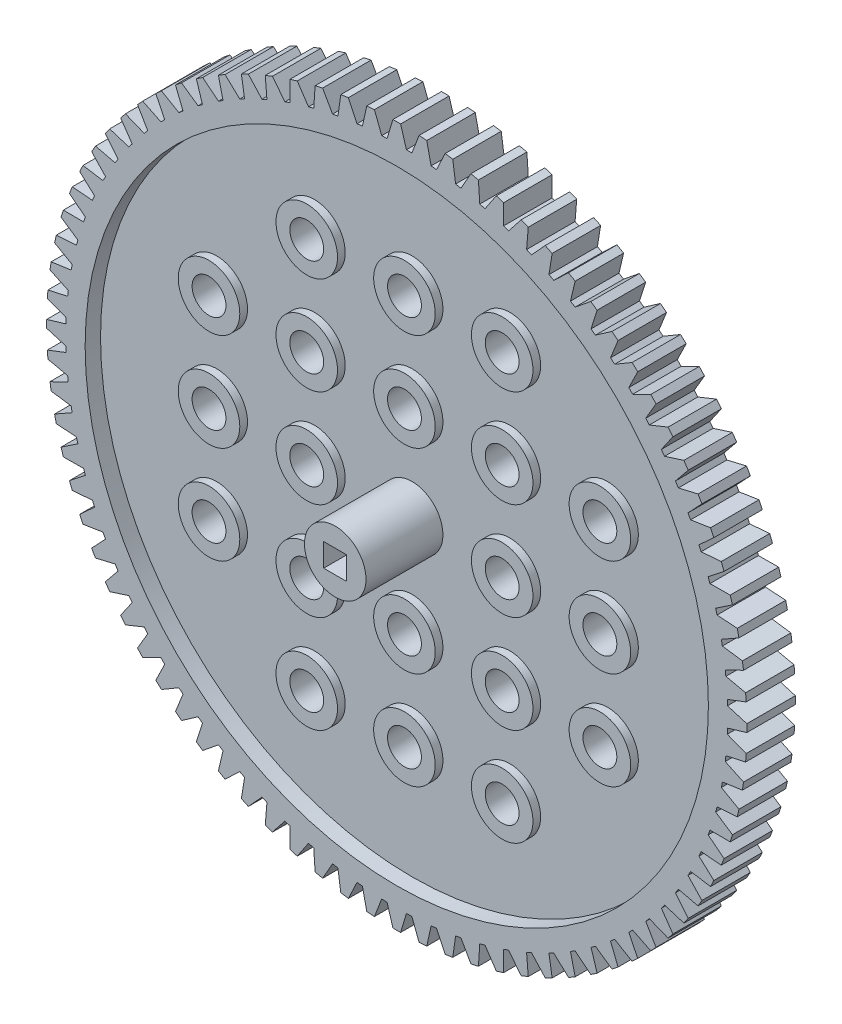
from build123d import *

# Parameters (mm, degrees)
SKETCH1_W           = 3
SKETCH1_H           = 3
BOSS_EXTRUDE1_DEPTH = 6.3
SKETCH2_R           = 2.2
CUT_EXTRUDE1_DEPTH  = 16.3
SKETCH3_R           = 40.5
CUT_EXTRUDE2_DEPTH  = 2
CUT_EXTRUDE3_START  = -2
SKETCH4_R           = 40.5
CUT_EXTRUDE3_DEPTH  = 2
BOSS_EXTRUDE2_START = 1
SKETCH5_R           = 4
SKETCH5_R_2         = 2.2
BOSS_EXTRUDE2_DEPTH = 1
SKETCH6_R           = 5.75
SKETCH6_R_2         = 4.25
BOSS_EXTRUDE3_DEPTH = 2
SKETCH7_R           = 4
SKETCH7_W           = 3
SKETCH7_H           = 3
BOSS_EXTRUDE4_DEPTH = 2
BOSS_EXTRUDE5_START = 2
SKETCH8_R           = 4
SKETCH8_W           = 3
SKETCH8_H           = 3
BOSS_EXTRUDE5_DEPTH = 2
SKETCH9_R           = 4
SKETCH9_W           = 3
SKETCH9_H           = 3
BOSS_EXTRUDE6_DEPTH = 8


with BuildPart() as part:
    # Sketch1 → Boss-Extrude1 (new body)
    with BuildSketch(Plane.XY):
        with BuildLine():
            Line((0.5, 45.5), (-0.5, 45.5))
            Line((-0.5, 45.5), (-1.255499823, 42.981667257))
            ThreePointArc((-1.255499823, 42.981667257), (-1.607821354, 42.969930306), (-1.960034826, 42.955305417))
            Line((-1.960034826, 42.955305417), (-2.90161736, 45.410137819))
            Line((-2.90161736, 45.410137819), (-3.898821157, 45.335407725))
            Line((-3.898821157, 45.335407725), (-4.464013207, 42.767658179))
            ThreePointArc((-4.464013207, 42.767658179), (-4.814472472, 42.729625025), (-5.164608165, 42.688720085))
            Line((-5.164608165, 42.688720085), (-6.287007698, 45.066323726))
            Line((-6.287007698, 45.066323726), (-7.275838524, 44.91728146))
            Line((-7.275838524, 44.91728146), (-7.647562019, 42.314475008))
            ThreePointArc((-7.647562019, 42.314475008), (-7.994199108, 42.250358349), (-8.34029892, 42.183402114))
            Line((-8.34029892, 42.183402114), (-9.637238539, 44.470480471))
            Line((-9.637238539, 44.470480471), (-10.612166451, 44.247959537))
            Line((-10.612166451, 44.247959537), (-10.788342562, 41.624652128))
            ThreePointArc((-10.788342562, 41.624652128), (-11.129218939, 41.53481053), (-11.46934734, 41.442177447))
            Line((-11.46934734, 41.442177447), (-12.933574033, 43.62594025))
            Line((-12.933574033, 43.62594025), (-13.889146839, 43.331185076))
            Line((-13.889146839, 43.331185076), (-13.868790317, 40.702047309))
            ThreePointArc((-13.868790317, 40.702047309), (-14.201999664, 40.586983203), (-14.534254518, 40.469191314))
            Line((-14.534254518, 40.469191314), (-16.157579734, 42.537426075))
            Line((-16.157579734, 42.537426075), (-17.088453483, 42.172085051))
            Line((-17.088453483, 42.172085051), (-16.871678171, 39.551820131))
            ThreePointArc((-16.871678171, 39.551820131), (-17.195357046, 39.412177002), (-17.517880249, 39.269885047))
            Line((-17.517880249, 39.269885047), (-19.291225696, 41.211025359))
            Line((-19.291225696, 41.211025359), (-20.192194564, 40.77714162))
            Line((-20.192194564, 40.77714162), (-19.780212757, 38.180403132))
            ThreePointArc((-19.780212757, 38.180403132), (-20.092551016, 38.016961921), (-20.403538887, 37.850965653))
            Line((-20.403538887, 37.850965653), (-22.316987298, 39.654155872))
            Line((-22.316987298, 39.654155872), (-23.183012702, 39.154155872))
            Line((-23.183012702, 39.154155872), (-22.57812837, 36.59546583))
            ThreePointArc((-22.57812837, 36.59546583), (-22.87737929, 36.409140567), (-23.17509266, 36.220368306))
            Line((-23.17509266, 36.220368306), (-25.217943255, 37.87552426))
            Line((-25.217943255, 37.87552426), (-26.044182029, 37.312204202))
            Line((-26.044182029, 37.312204202), (-25.24977793, 34.805871839))
            ThreePointArc((-25.24977793, 34.805871839), (-25.53426798, 34.59770453), (-25.817041914, 34.387211966))
            Line((-25.817041914, 34.387211966), (-27.977870243, 35.885077353))
            Line((-27.977870243, 35.885077353), (-28.759701726, 35.261587551))
            Line((-28.759701726, 35.261587551), (-27.780220489, 32.821629295))
            ThreePointArc((-27.780220489, 32.821629295), (-28.048358685, 32.592784095), (-28.314611797, 32.361748389))
            Line((-28.314611797, 32.361748389), (-30.581333633, 33.693946537))
            Line((-30.581333633, 33.693946537), (-31.314385504, 33.013773799))
            Line((-31.314385504, 33.013773799), (-30.155304787, 30.653834885))
            ThreePointArc((-30.155304787, 30.653834885), (-30.405591591, 30.405591591), (-30.653834885, 30.155304787))
            Line((-30.653834885, 30.155304787), (-33.013773799, 31.314385504))
            Line((-33.013773799, 31.314385504), (-33.693946537, 30.581333633))
            Line((-33.693946537, 30.581333633), (-32.361748389, 28.314611797))
            ThreePointArc((-32.361748389, 28.314611797), (-32.592784095, 28.048358685), (-32.821629295, 27.780220489))
            Line((-32.821629295, 27.780220489), (-35.261587551, 28.759701726))
            Line((-35.261587551, 28.759701726), (-35.885077353, 27.977870243))
            Line((-35.885077353, 27.977870243), (-34.387211966, 25.817041914))
            ThreePointArc((-34.387211966, 25.817041914), (-34.59770453, 25.53426798), (-34.805871839, 25.24977793))
            Line((-34.805871839, 25.24977793), (-37.312204202, 26.044182029))
            Line((-37.312204202, 26.044182029), (-37.87552426, 25.217943255))
            Line((-37.87552426, 25.217943255), (-36.220368306, 23.17509266))
            ThreePointArc((-36.220368306, 23.17509266), (-36.409140567, 22.87737929), (-36.59546583, 22.57812837))
            Line((-36.59546583, 22.57812837), (-39.154155872, 23.183012702))
            Line((-39.154155872, 23.183012702), (-39.654155872, 22.316987298))
            Line((-39.654155872, 22.316987298), (-37.850965653, 20.403538887))
            ThreePointArc((-37.850965653, 20.403538887), (-38.016961921, 20.092551016), (-38.180403132, 19.780212757))
            Line((-38.180403132, 19.780212757), (-40.77714162, 20.192194564))
            Line((-40.77714162, 20.192194564), (-41.211025359, 19.291225696))
            Line((-41.211025359, 19.291225696), (-39.269885047, 17.517880249))
            ThreePointArc((-39.269885047, 17.517880249), (-39.412177002, 17.195357046), (-39.551820131, 16.871678171))
            Line((-39.551820131, 16.871678171), (-42.172085051, 17.088453483))
            Line((-42.172085051, 17.088453483), (-42.537426075, 16.157579734))
            Line((-42.537426075, 16.157579734), (-40.469191314, 14.534254518))
            ThreePointArc((-40.469191314, 14.534254518), (-40.586983203, 14.201999664), (-40.702047309, 13.868790317))
            Line((-40.702047309, 13.868790317), (-43.331185076, 13.889146839))
            Line((-43.331185076, 13.889146839), (-43.62594025, 12.933574033))
            Line((-43.62594025, 12.933574033), (-41.442177447, 11.46934734))
            ThreePointArc((-41.442177447, 11.46934734), (-41.53481053, 11.129218939), (-41.624652128, 10.788342562))
            Line((-41.624652128, 10.788342562), (-44.247959537, 10.612166451))
            Line((-44.247959537, 10.612166451), (-44.470480471, 9.637238539))
            Line((-44.470480471, 9.637238539), (-42.183402114, 8.34029892))
            ThreePointArc((-42.183402114, 8.34029892), (-42.250358349, 7.994199108), (-42.314475008, 7.647562019))
            Line((-42.314475008, 7.647562019), (-44.91728146, 7.275838524))
            Line((-44.91728146, 7.275838524), (-45.066323726, 6.287007698))
            Line((-45.066323726, 6.287007698), (-42.688720085, 5.164608165))
            ThreePointArc((-42.688720085, 5.164608165), (-42.729625025, 4.814472472), (-42.767658179, 4.464013207))
            Line((-42.767658179, 4.464013207), (-45.335407725, 3.898821157))
            Line((-45.335407725, 3.898821157), (-45.410137819, 2.90161736))
            Line((-45.410137819, 2.90161736), (-42.955305417, 1.960034826))
            ThreePointArc((-42.955305417, 1.960034826), (-42.969930306, 1.607821354), (-42.981667257, 1.255499823))
            Line((-42.981667257, 1.255499823), (-45.5, 0.5))
            Line((-45.5, 0.5), (-45.5, -0.5))
            Line((-45.5, -0.5), (-42.981667257, -1.255499823))
            ThreePointArc((-42.981667257, -1.255499823), (-42.969930306, -1.607821354), (-42.955305417, -1.960034826))
            Line((-42.955305417, -1.960034826), (-45.410137819, -2.90161736))
            Line((-45.410137819, -2.90161736), (-45.335407725, -3.898821157))
            Line((-45.335407725, -3.898821157), (-42.767658179, -4.464013207))
            ThreePointArc((-42.767658179, -4.464013207), (-42.729625025, -4.814472472), (-42.688720085, -5.164608165))
            Line((-42.688720085, -5.164608165), (-45.066323726, -6.287007698))
            Line((-45.066323726, -6.287007698), (-44.91728146, -7.275838524))
            Line((-44.91728146, -7.275838524), (-42.314475008, -7.647562019))
            ThreePointArc((-42.314475008, -7.647562019), (-42.250358349, -7.994199108), (-42.183402114, -8.34029892))
            Line((-42.183402114, -8.34029892), (-44.470480471, -9.637238539))
            Line((-44.470480471, -9.637238539), (-44.247959537, -10.612166451))
            Line((-44.247959537, -10.612166451), (-41.624652128, -10.788342562))
            ThreePointArc((-41.624652128, -10.788342562), (-41.53481053, -11.129218939), (-41.442177447, -11.46934734))
            Line((-41.442177447, -11.46934734), (-43.62594025, -12.933574033))
            Line((-43.62594025, -12.933574033), (-43.331185076, -13.889146839))
            Line((-43.331185076, -13.889146839), (-40.702047309, -13.868790317))
            ThreePointArc((-40.702047309, -13.868790317), (-40.586983203, -14.201999664), (-40.469191314, -14.534254518))
            Line((-40.469191314, -14.534254518), (-42.537426075, -16.157579734))
            Line((-42.537426075, -16.157579734), (-42.172085051, -17.088453483))
            Line((-42.172085051, -17.088453483), (-39.551820131, -16.871678171))
            ThreePointArc((-39.551820131, -16.871678171), (-39.412177002, -17.195357046), (-39.269885047, -17.517880249))
            Line((-39.269885047, -17.517880249), (-41.211025359, -19.291225696))
            Line((-41.211025359, -19.291225696), (-40.77714162, -20.192194564))
            Line((-40.77714162, -20.192194564), (-38.180403132, -19.780212757))
            ThreePointArc((-38.180403132, -19.780212757), (-38.016961921, -20.092551016), (-37.850965653, -20.403538887))
            Line((-37.850965653, -20.403538887), (-39.654155872, -22.316987298))
            Line((-39.654155872, -22.316987298), (-39.154155872, -23.183012702))
            Line((-39.154155872, -23.183012702), (-36.59546583, -22.57812837))
            ThreePointArc((-36.59546583, -22.57812837), (-36.409140567, -22.87737929), (-36.220368306, -23.17509266))
            Line((-36.220368306, -23.17509266), (-37.87552426, -25.217943255))
            Line((-37.87552426, -25.217943255), (-37.312204202, -26.044182029))
            Line((-37.312204202, -26.044182029), (-34.805871839, -25.24977793))
            ThreePointArc((-34.805871839, -25.24977793), (-34.59770453, -25.53426798), (-34.387211966, -25.817041914))
            Line((-34.387211966, -25.817041914), (-35.885077353, -27.977870243))
            Line((-35.885077353, -27.977870243), (-35.261587551, -28.759701726))
            Line((-35.261587551, -28.759701726), (-32.821629295, -27.780220489))
            ThreePointArc((-32.821629295, -27.780220489), (-32.592784095, -28.048358685), (-32.361748389, -28.314611797))
            Line((-32.361748389, -28.314611797), (-33.693946537, -30.581333633))
            Line((-33.693946537, -30.581333633), (-33.013773799, -31.314385504))
            Line((-33.013773799, -31.314385504), (-30.653834885, -30.155304787))
            ThreePointArc((-30.653834885, -30.155304787), (-30.405591591, -30.405591591), (-30.155304787, -30.653834885))
            Line((-30.155304787, -30.653834885), (-31.314385504, -33.013773799))
            Line((-31.314385504, -33.013773799), (-30.581333633, -33.693946537))
            Line((-30.581333633, -33.693946537), (-28.314611797, -32.361748389))
            ThreePointArc((-28.314611797, -32.361748389), (-28.048358685, -32.592784095), (-27.780220489, -32.821629295))
            Line((-27.780220489, -32.821629295), (-28.759701726, -35.261587551))
            Line((-28.759701726, -35.261587551), (-27.977870243, -35.885077353))
            Line((-27.977870243, -35.885077353), (-25.817041914, -34.387211966))
            ThreePointArc((-25.817041914, -34.387211966), (-25.53426798, -34.59770453), (-25.24977793, -34.805871839))
            Line((-25.24977793, -34.805871839), (-26.044182029, -37.312204202))
            Line((-26.044182029, -37.312204202), (-25.217943255, -37.87552426))
            Line((-25.217943255, -37.87552426), (-23.17509266, -36.220368306))
            ThreePointArc((-23.17509266, -36.220368306), (-22.87737929, -36.409140567), (-22.57812837, -36.59546583))
            Line((-22.57812837, -36.59546583), (-23.183012702, -39.154155872))
            Line((-23.183012702, -39.154155872), (-22.316987298, -39.654155872))
            Line((-22.316987298, -39.654155872), (-20.403538887, -37.850965653))
            ThreePointArc((-20.403538887, -37.850965653), (-20.092551016, -38.016961921), (-19.780212757, -38.180403132))
            Line((-19.780212757, -38.180403132), (-20.192194564, -40.77714162))
            Line((-20.192194564, -40.77714162), (-19.291225696, -41.211025359))
            Line((-19.291225696, -41.211025359), (-17.517880249, -39.269885047))
            ThreePointArc((-17.517880249, -39.269885047), (-17.195357046, -39.412177002), (-16.871678171, -39.551820131))
            Line((-16.871678171, -39.551820131), (-17.088453483, -42.172085051))
            Line((-17.088453483, -42.172085051), (-16.157579734, -42.537426075))
            Line((-16.157579734, -42.537426075), (-14.534254518, -40.469191314))
            ThreePointArc((-14.534254518, -40.469191314), (-14.201999664, -40.586983203), (-13.868790317, -40.702047309))
            Line((-13.868790317, -40.702047309), (-13.889146839, -43.331185076))
            Line((-13.889146839, -43.331185076), (-12.933574033, -43.62594025))
            Line((-12.933574033, -43.62594025), (-11.46934734, -41.442177447))
            ThreePointArc((-11.46934734, -41.442177447), (-11.129218939, -41.53481053), (-10.788342562, -41.624652128))
            Line((-10.788342562, -41.624652128), (-10.612166451, -44.247959537))
            Line((-10.612166451, -44.247959537), (-9.637238539, -44.470480471))
            Line((-9.637238539, -44.470480471), (-8.34029892, -42.183402114))
            ThreePointArc((-8.34029892, -42.183402114), (-7.994199108, -42.250358349), (-7.647562019, -42.314475008))
            Line((-7.647562019, -42.314475008), (-7.275838524, -44.91728146))
            Line((-7.275838524, -44.91728146), (-6.287007698, -45.066323726))
            Line((-6.287007698, -45.066323726), (-5.164608165, -42.688720085))
            ThreePointArc((-5.164608165, -42.688720085), (-4.814472472, -42.729625025), (-4.464013207, -42.767658179))
            Line((-4.464013207, -42.767658179), (-3.898821157, -45.335407725))
            Line((-3.898821157, -45.335407725), (-2.90161736, -45.410137819))
            Line((-2.90161736, -45.410137819), (-1.960034826, -42.955305417))
            ThreePointArc((-1.960034826, -42.955305417), (-1.607821354, -42.969930306), (-1.255499823, -42.981667257))
            Line((-1.255499823, -42.981667257), (-0.5, -45.5))
            Line((-0.5, -45.5), (0.5, -45.5))
            Line((0.5, -45.5), (1.255499823, -42.981667257))
            ThreePointArc((1.255499823, -42.981667257), (1.607821354, -42.969930306), (1.960034826, -42.955305417))
            Line((1.960034826, -42.955305417), (2.90161736, -45.410137819))
            Line((2.90161736, -45.410137819), (3.898821157, -45.335407725))
            Line((3.898821157, -45.335407725), (4.464013207, -42.767658179))
            ThreePointArc((4.464013207, -42.767658179), (4.814472472, -42.729625025), (5.164608165, -42.688720085))
            Line((5.164608165, -42.688720085), (6.287007698, -45.066323726))
            Line((6.287007698, -45.066323726), (7.275838524, -44.91728146))
            Line((7.275838524, -44.91728146), (7.647562019, -42.314475008))
            ThreePointArc((7.647562019, -42.314475008), (7.994199108, -42.250358349), (8.34029892, -42.183402114))
            Line((8.34029892, -42.183402114), (9.637238539, -44.470480471))
            Line((9.637238539, -44.470480471), (10.612166451, -44.247959537))
            Line((10.612166451, -44.247959537), (10.788342562, -41.624652128))
            ThreePointArc((10.788342562, -41.624652128), (11.129218939, -41.53481053), (11.46934734, -41.442177447))
            Line((11.46934734, -41.442177447), (12.933574033, -43.62594025))
            Line((12.933574033, -43.62594025), (13.889146839, -43.331185076))
            Line((13.889146839, -43.331185076), (13.868790317, -40.702047309))
            ThreePointArc((13.868790317, -40.702047309), (14.201999664, -40.586983203), (14.534254518, -40.469191314))
            Line((14.534254518, -40.469191314), (16.157579734, -42.537426075))
            Line((16.157579734, -42.537426075), (17.088453483, -42.172085051))
            Line((17.088453483, -42.172085051), (16.871678171, -39.551820131))
            ThreePointArc((16.871678171, -39.551820131), (17.195357046, -39.412177002), (17.517880249, -39.269885047))
            Line((17.517880249, -39.269885047), (19.291225696, -41.211025359))
            Line((19.291225696, -41.211025359), (20.192194564, -40.77714162))
            Line((20.192194564, -40.77714162), (19.780212757, -38.180403132))
            ThreePointArc((19.780212757, -38.180403132), (20.092551016, -38.016961921), (20.403538887, -37.850965653))
            Line((20.403538887, -37.850965653), (22.316987298, -39.654155872))
            Line((22.316987298, -39.654155872), (23.183012702, -39.154155872))
            Line((23.183012702, -39.154155872), (22.57812837, -36.59546583))
            ThreePointArc((22.57812837, -36.59546583), (22.87737929, -36.409140567), (23.17509266, -36.220368306))
            Line((23.17509266, -36.220368306), (25.217943255, -37.87552426))
            Line((25.217943255, -37.87552426), (26.044182029, -37.312204202))
            Line((26.044182029, -37.312204202), (25.24977793, -34.805871839))
            ThreePointArc((25.24977793, -34.805871839), (25.53426798, -34.59770453), (25.817041914, -34.387211966))
            Line((25.817041914, -34.387211966), (27.977870243, -35.885077353))
            Line((27.977870243, -35.885077353), (28.759701726, -35.261587551))
            Line((28.759701726, -35.261587551), (27.780220489, -32.821629295))
            ThreePointArc((27.780220489, -32.821629295), (28.048358685, -32.592784095), (28.314611797, -32.361748389))
            Line((28.314611797, -32.361748389), (30.581333633, -33.693946537))
            Line((30.581333633, -33.693946537), (31.314385504, -33.013773799))
            Line((31.314385504, -33.013773799), (30.155304787, -30.653834885))
            ThreePointArc((30.155304787, -30.653834885), (30.405591591, -30.405591591), (30.653834885, -30.155304787))
            Line((30.653834885, -30.155304787), (33.013773799, -31.314385504))
            Line((33.013773799, -31.314385504), (33.693946537, -30.581333633))
            Line((33.693946537, -30.581333633), (32.361748389, -28.314611797))
            ThreePointArc((32.361748389, -28.314611797), (32.592784095, -28.048358685), (32.821629295, -27.780220489))
            Line((32.821629295, -27.780220489), (35.261587551, -28.759701726))
            Line((35.261587551, -28.759701726), (35.885077353, -27.977870243))
            Line((35.885077353, -27.977870243), (34.387211966, -25.817041914))
            ThreePointArc((34.387211966, -25.817041914), (34.59770453, -25.53426798), (34.805871839, -25.24977793))
            Line((34.805871839, -25.24977793), (37.312204202, -26.044182029))
            Line((37.312204202, -26.044182029), (37.87552426, -25.217943255))
            Line((37.87552426, -25.217943255), (36.220368306, -23.17509266))
            ThreePointArc((36.220368306, -23.17509266), (36.409140567, -22.87737929), (36.59546583, -22.57812837))
            Line((36.59546583, -22.57812837), (39.154155872, -23.183012702))
            Line((39.154155872, -23.183012702), (39.654155872, -22.316987298))
            Line((39.654155872, -22.316987298), (37.850965653, -20.403538887))
            ThreePointArc((37.850965653, -20.403538887), (38.016961921, -20.092551016), (38.180403132, -19.780212757))
            Line((38.180403132, -19.780212757), (40.77714162, -20.192194564))
            Line((40.77714162, -20.192194564), (41.211025359, -19.291225696))
            Line((41.211025359, -19.291225696), (39.269885047, -17.517880249))
            ThreePointArc((39.269885047, -17.517880249), (39.412177002, -17.195357046), (39.551820131, -16.871678171))
            Line((39.551820131, -16.871678171), (42.172085051, -17.088453483))
            Line((42.172085051, -17.088453483), (42.537426075, -16.157579734))
            Line((42.537426075, -16.157579734), (40.469191314, -14.534254518))
            ThreePointArc((40.469191314, -14.534254518), (40.586983203, -14.201999664), (40.702047309, -13.868790317))
            Line((40.702047309, -13.868790317), (43.331185076, -13.889146839))
            Line((43.331185076, -13.889146839), (43.62594025, -12.933574033))
            Line((43.62594025, -12.933574033), (41.442177447, -11.46934734))
            ThreePointArc((41.442177447, -11.46934734), (41.53481053, -11.129218939), (41.624652128, -10.788342562))
            Line((41.624652128, -10.788342562), (44.247959537, -10.612166451))
            Line((44.247959537, -10.612166451), (44.470480471, -9.637238539))
            Line((44.470480471, -9.637238539), (42.183402114, -8.34029892))
            ThreePointArc((42.183402114, -8.34029892), (42.250358349, -7.994199108), (42.314475008, -7.647562019))
            Line((42.314475008, -7.647562019), (44.91728146, -7.275838524))
            Line((44.91728146, -7.275838524), (45.066323726, -6.287007698))
            Line((45.066323726, -6.287007698), (42.688720085, -5.164608165))
            ThreePointArc((42.688720085, -5.164608165), (42.729625025, -4.814472472), (42.767658179, -4.464013207))
            Line((42.767658179, -4.464013207), (45.335407725, -3.898821157))
            Line((45.335407725, -3.898821157), (45.410137819, -2.90161736))
            Line((45.410137819, -2.90161736), (42.955305417, -1.960034826))
            ThreePointArc((42.955305417, -1.960034826), (42.969930306, -1.607821354), (42.981667257, -1.255499823))
            Line((42.981667257, -1.255499823), (45.5, -0.5))
            Line((45.5, -0.5), (45.5, 0.5))
            Line((45.5, 0.5), (42.981667257, 1.255499823))
            ThreePointArc((42.981667257, 1.255499823), (42.969930306, 1.607821354), (42.955305417, 1.960034826))
            Line((42.955305417, 1.960034826), (45.410137819, 2.90161736))
            Line((45.410137819, 2.90161736), (45.335407725, 3.898821157))
            Line((45.335407725, 3.898821157), (42.767658179, 4.464013207))
            ThreePointArc((42.767658179, 4.464013207), (42.729625025, 4.814472472), (42.688720085, 5.164608165))
            Line((42.688720085, 5.164608165), (45.066323726, 6.287007698))
            Line((45.066323726, 6.287007698), (44.91728146, 7.275838524))
            Line((44.91728146, 7.275838524), (42.314475008, 7.647562019))
            ThreePointArc((42.314475008, 7.647562019), (42.250358349, 7.994199108), (42.183402114, 8.34029892))
            Line((42.183402114, 8.34029892), (44.470480471, 9.637238539))
            Line((44.470480471, 9.637238539), (44.247959537, 10.612166451))
            Line((44.247959537, 10.612166451), (41.624652128, 10.788342562))
            ThreePointArc((41.624652128, 10.788342562), (41.53481053, 11.129218939), (41.442177447, 11.46934734))
            Line((41.442177447, 11.46934734), (43.62594025, 12.933574033))
            Line((43.62594025, 12.933574033), (43.331185076, 13.889146839))
            Line((43.331185076, 13.889146839), (40.702047309, 13.868790317))
            ThreePointArc((40.702047309, 13.868790317), (40.586983203, 14.201999664), (40.469191314, 14.534254518))
            Line((40.469191314, 14.534254518), (42.537426075, 16.157579734))
            Line((42.537426075, 16.157579734), (42.172085051, 17.088453483))
            Line((42.172085051, 17.088453483), (39.551820131, 16.871678171))
            ThreePointArc((39.551820131, 16.871678171), (39.412177002, 17.195357046), (39.269885047, 17.517880249))
            Line((39.269885047, 17.517880249), (41.211025359, 19.291225696))
            Line((41.211025359, 19.291225696), (40.77714162, 20.192194564))
            Line((40.77714162, 20.192194564), (38.180403132, 19.780212757))
            ThreePointArc((38.180403132, 19.780212757), (38.016961921, 20.092551016), (37.850965653, 20.403538887))
            Line((37.850965653, 20.403538887), (39.654155872, 22.316987298))
            Line((39.654155872, 22.316987298), (39.154155872, 23.183012702))
            Line((39.154155872, 23.183012702), (36.59546583, 22.57812837))
            ThreePointArc((36.59546583, 22.57812837), (36.409140567, 22.87737929), (36.220368306, 23.17509266))
            Line((36.220368306, 23.17509266), (37.87552426, 25.217943255))
            Line((37.87552426, 25.217943255), (37.312204202, 26.044182029))
            Line((37.312204202, 26.044182029), (34.805871839, 25.24977793))
            ThreePointArc((34.805871839, 25.24977793), (34.59770453, 25.53426798), (34.387211966, 25.817041914))
            Line((34.387211966, 25.817041914), (35.885077353, 27.977870243))
            Line((35.885077353, 27.977870243), (35.261587551, 28.759701726))
            Line((35.261587551, 28.759701726), (32.821629295, 27.780220489))
            ThreePointArc((32.821629295, 27.780220489), (32.592784095, 28.048358685), (32.361748389, 28.314611797))
            Line((32.361748389, 28.314611797), (33.693946537, 30.581333633))
            Line((33.693946537, 30.581333633), (33.013773799, 31.314385504))
            Line((33.013773799, 31.314385504), (30.653834885, 30.155304787))
            ThreePointArc((30.653834885, 30.155304787), (30.405591591, 30.405591591), (30.155304787, 30.653834885))
            Line((30.155304787, 30.653834885), (31.314385504, 33.013773799))
            Line((31.314385504, 33.013773799), (30.581333633, 33.693946537))
            Line((30.581333633, 33.693946537), (28.314611797, 32.361748389))
            ThreePointArc((28.314611797, 32.361748389), (28.048358685, 32.592784095), (27.780220489, 32.821629295))
            Line((27.780220489, 32.821629295), (28.759701726, 35.261587551))
            Line((28.759701726, 35.261587551), (27.977870243, 35.885077353))
            Line((27.977870243, 35.885077353), (25.817041914, 34.387211966))
            ThreePointArc((25.817041914, 34.387211966), (25.53426798, 34.59770453), (25.24977793, 34.805871839))
            Line((25.24977793, 34.805871839), (26.044182029, 37.312204202))
            Line((26.044182029, 37.312204202), (25.217943255, 37.87552426))
            Line((25.217943255, 37.87552426), (23.17509266, 36.220368306))
            ThreePointArc((23.17509266, 36.220368306), (22.87737929, 36.409140567), (22.57812837, 36.59546583))
            Line((22.57812837, 36.59546583), (23.183012702, 39.154155872))
            Line((23.183012702, 39.154155872), (22.316987298, 39.654155872))
            Line((22.316987298, 39.654155872), (20.403538887, 37.850965653))
            ThreePointArc((20.403538887, 37.850965653), (20.092551016, 38.016961921), (19.780212757, 38.180403132))
            Line((19.780212757, 38.180403132), (20.192194564, 40.77714162))
            Line((20.192194564, 40.77714162), (19.291225696, 41.211025359))
            Line((19.291225696, 41.211025359), (17.517880249, 39.269885047))
            ThreePointArc((17.517880249, 39.269885047), (17.195357046, 39.412177002), (16.871678171, 39.551820131))
            Line((16.871678171, 39.551820131), (17.088453483, 42.172085051))
            Line((17.088453483, 42.172085051), (16.157579734, 42.537426075))
            Line((16.157579734, 42.537426075), (14.534254518, 40.469191314))
            ThreePointArc((14.534254518, 40.469191314), (14.201999664, 40.586983203), (13.868790317, 40.702047309))
            Line((13.868790317, 40.702047309), (13.889146839, 43.331185076))
            Line((13.889146839, 43.331185076), (12.933574033, 43.62594025))
            Line((12.933574033, 43.62594025), (11.46934734, 41.442177447))
            ThreePointArc((11.46934734, 41.442177447), (11.129218939, 41.53481053), (10.788342562, 41.624652128))
            Line((10.788342562, 41.624652128), (10.612166451, 44.247959537))
            Line((10.612166451, 44.247959537), (9.637238539, 44.470480471))
            Line((9.637238539, 44.470480471), (8.34029892, 42.183402114))
            ThreePointArc((8.34029892, 42.183402114), (7.994199108, 42.250358349), (7.647562019, 42.314475008))
            Line((7.647562019, 42.314475008), (7.275838524, 44.91728146))
            Line((7.275838524, 44.91728146), (6.287007698, 45.066323726))
            Line((6.287007698, 45.066323726), (5.164608165, 42.688720085))
            ThreePointArc((5.164608165, 42.688720085), (4.814472472, 42.729625025), (4.464013207, 42.767658179))
            Line((4.464013207, 42.767658179), (3.898821157, 45.335407725))
            Line((3.898821157, 45.335407725), (2.90161736, 45.410137819))
            Line((2.90161736, 45.410137819), (1.960034826, 42.955305417))
            ThreePointArc((1.960034826, 42.955305417), (1.607821354, 42.969930306), (1.255499823, 42.981667257))
            Line((1.255499823, 42.981667257), (0.5, 45.5))
        make_face()
        Rectangle(SKETCH1_W, SKETCH1_H, mode=Mode.SUBTRACT)
    extrude(amount=BOSS_EXTRUDE1_DEPTH)

    # Sketch2 → Cut-Extrude1 (cut)
    with BuildSketch(Plane.XY.offset(6.3)):
        with Locations((0, 25.4)):
            Circle(SKETCH2_R)
        with Locations((0, 12.7)):
            Circle(SKETCH2_R)
        with Locations((0, -12.7)):
            Circle(SKETCH2_R)
        with Locations((0, -25.4)):
            Circle(SKETCH2_R)
        with Locations((12.7, 25.4)):
            Circle(SKETCH2_R)
        with Locations((12.7, 12.7)):
            Circle(SKETCH2_R)
        with Locations((12.7, -12.7)):
            Circle(SKETCH2_R)
        with Locations((12.7, -25.4)):
            Circle(SKETCH2_R)
        with Locations((-12.7, 25.4)):
            Circle(SKETCH2_R)
        with Locations((-12.7, 12.7)):
            Circle(SKETCH2_R)
        with Locations((-12.7, -12.7)):
            Circle(SKETCH2_R)
        with Locations((-12.7, -25.4)):
            Circle(SKETCH2_R)
        with Locations((-12.7, 0)):
            Circle(SKETCH2_R)
        with Locations((12.7, 0)):
            Circle(SKETCH2_R)
        with Locations((-25.4, 0)):
            Circle(SKETCH2_R)
        with Locations((25.4, 0)):
            Circle(SKETCH2_R)
        with Locations((-25.4, 12.7)):
            Circle(SKETCH2_R)
        with Locations((25.4, 12.7)):
            Circle(SKETCH2_R)
        with Locations((-25.4, -12.7)):
            Circle(SKETCH2_R)
        with Locations((25.4, -12.7)):
            Circle(SKETCH2_R)
    extrude(amount=-CUT_EXTRUDE1_DEPTH, mode=Mode.SUBTRACT)

    # Sketch3 → Cut-Extrude2 (cut)
    with BuildSketch(Plane.XY.offset(6.3)):
        Circle(SKETCH3_R)
    extrude(amount=-CUT_EXTRUDE2_DEPTH, mode=Mode.SUBTRACT)

    # Sketch4 → Cut-Extrude3 (cut)
    with BuildSketch(Plane(origin=(0, 0, 0), x_dir=(-1, 0, 0), z_dir=(0, 0, -1)).offset(CUT_EXTRUDE3_START)):
        Circle(SKETCH4_R)
    extrude(amount=CUT_EXTRUDE3_DEPTH, mode=Mode.SUBTRACT)

    # Sketch5 → Boss-Extrude2 (add)
    # profile 1 of 20: a face of its own
    with BuildSketch(Plane.XY.offset(4.3).offset(BOSS_EXTRUDE2_START)):
        with Locations((-12.7, 25.4)):
            Circle(SKETCH5_R)
        with Locations((-12.7, 25.4)):
            Circle(SKETCH5_R_2, mode=Mode.SUBTRACT)
    # profile 2 of 20: a face of its own
    with BuildSketch(Plane.XY.offset(4.3).offset(BOSS_EXTRUDE2_START)):
        with Locations((-25.4, 12.7)):
            Circle(SKETCH5_R)
        with Locations((-25.4, 12.7)):
            Circle(SKETCH5_R_2, mode=Mode.SUBTRACT)
    # profile 3 of 20: a face of its own
    with BuildSketch(Plane.XY.offset(4.3).offset(BOSS_EXTRUDE2_START)):
        with Locations((-25.4, 0)):
            Circle(SKETCH5_R)
        with Locations((-25.4, 0)):
            Circle(SKETCH5_R_2, mode=Mode.SUBTRACT)
    # profile 4 of 20: a face of its own
    with BuildSketch(Plane.XY.offset(4.3).offset(BOSS_EXTRUDE2_START)):
        with Locations((-25.4, -12.7)):
            Circle(SKETCH5_R)
        with Locations((-25.4, -12.7)):
            Circle(SKETCH5_R_2, mode=Mode.SUBTRACT)
    # profile 5 of 20: a face of its own
    with BuildSketch(Plane.XY.offset(4.3).offset(BOSS_EXTRUDE2_START)):
        with Locations((-12.7, -25.4)):
            Circle(SKETCH5_R)
        with Locations((-12.7, -25.4)):
            Circle(SKETCH5_R_2, mode=Mode.SUBTRACT)
    # profile 6 of 20: a face of its own
    with BuildSketch(Plane.XY.offset(4.3).offset(BOSS_EXTRUDE2_START)):
        with Locations((0, 25.4)):
            Circle(SKETCH5_R)
        with Locations((0, 25.4)):
            Circle(SKETCH5_R_2, mode=Mode.SUBTRACT)
    # profile 7 of 20: a face of its own
    with BuildSketch(Plane.XY.offset(4.3).offset(BOSS_EXTRUDE2_START)):
        with Locations((0, -25.4)):
            Circle(SKETCH5_R)
        with Locations((0, -25.4)):
            Circle(SKETCH5_R_2, mode=Mode.SUBTRACT)
    # profile 8 of 20: a face of its own
    with BuildSketch(Plane.XY.offset(4.3).offset(BOSS_EXTRUDE2_START)):
        with Locations((12.7, 25.4)):
            Circle(SKETCH5_R)
        with Locations((12.7, 25.4)):
            Circle(SKETCH5_R_2, mode=Mode.SUBTRACT)
    # profile 9 of 20: a face of its own
    with BuildSketch(Plane.XY.offset(4.3).offset(BOSS_EXTRUDE2_START)):
        with Locations((12.7, -25.4)):
            Circle(SKETCH5_R)
        with Locations((12.7, -25.4)):
            Circle(SKETCH5_R_2, mode=Mode.SUBTRACT)
    # profile 10 of 20: a face of its own
    with BuildSketch(Plane.XY.offset(4.3).offset(BOSS_EXTRUDE2_START)):
        with Locations((-12.7, 12.7)):
            Circle(SKETCH5_R)
        with Locations((-12.7, 12.7)):
            Circle(SKETCH5_R_2, mode=Mode.SUBTRACT)
    # profile 11 of 20: a face of its own
    with BuildSketch(Plane.XY.offset(4.3).offset(BOSS_EXTRUDE2_START)):
        with Locations((-12.7, 0)):
            Circle(SKETCH5_R)
        with Locations((-12.7, 0)):
            Circle(SKETCH5_R_2, mode=Mode.SUBTRACT)
    # profile 12 of 20: a face of its own
    with BuildSketch(Plane.XY.offset(4.3).offset(BOSS_EXTRUDE2_START)):
        with Locations((-12.7, -12.7)):
            Circle(SKETCH5_R)
        with Locations((-12.7, -12.7)):
            Circle(SKETCH5_R_2, mode=Mode.SUBTRACT)
    # profile 13 of 20: a face of its own
    with BuildSketch(Plane.XY.offset(4.3).offset(BOSS_EXTRUDE2_START)):
        with Locations((0, 12.7)):
            Circle(SKETCH5_R)
        with Locations((0, 12.7)):
            Circle(SKETCH5_R_2, mode=Mode.SUBTRACT)
    # profile 14 of 20: a face of its own
    with BuildSketch(Plane.XY.offset(4.3).offset(BOSS_EXTRUDE2_START)):
        with Locations((0, -12.7)):
            Circle(SKETCH5_R)
        with Locations((0, -12.7)):
            Circle(SKETCH5_R_2, mode=Mode.SUBTRACT)
    # profile 15 of 20: a face of its own
    with BuildSketch(Plane.XY.offset(4.3).offset(BOSS_EXTRUDE2_START)):
        with Locations((12.7, 12.7)):
            Circle(SKETCH5_R)
        with Locations((12.7, 12.7)):
            Circle(SKETCH5_R_2, mode=Mode.SUBTRACT)
    # profile 16 of 20: a face of its own
    with BuildSketch(Plane.XY.offset(4.3).offset(BOSS_EXTRUDE2_START)):
        with Locations((12.7, 0)):
            Circle(SKETCH5_R)
        with Locations((12.7, 0)):
            Circle(SKETCH5_R_2, mode=Mode.SUBTRACT)
    # profile 17 of 20: a face of its own
    with BuildSketch(Plane.XY.offset(4.3).offset(BOSS_EXTRUDE2_START)):
        with Locations((12.7, -12.7)):
            Circle(SKETCH5_R)
        with Locations((12.7, -12.7)):
            Circle(SKETCH5_R_2, mode=Mode.SUBTRACT)
    # profile 18 of 20: a face of its own
    with BuildSketch(Plane.XY.offset(4.3).offset(BOSS_EXTRUDE2_START)):
        with Locations((25.4, 12.7)):
            Circle(SKETCH5_R)
        with Locations((25.4, 12.7)):
            Circle(SKETCH5_R_2, mode=Mode.SUBTRACT)
    # profile 19 of 20: a face of its own
    with BuildSketch(Plane.XY.offset(4.3).offset(BOSS_EXTRUDE2_START)):
        with Locations((25.4, 0)):
            Circle(SKETCH5_R)
        with Locations((25.4, 0)):
            Circle(SKETCH5_R_2, mode=Mode.SUBTRACT)
    # profile 20 of 20: a face of its own
    with BuildSketch(Plane.XY.offset(4.3).offset(BOSS_EXTRUDE2_START)):
        with Locations((25.4, -12.7)):
            Circle(SKETCH5_R)
        with Locations((25.4, -12.7)):
            Circle(SKETCH5_R_2, mode=Mode.SUBTRACT)
    extrude(amount=-BOSS_EXTRUDE2_DEPTH)

    # Sketch6 → Boss-Extrude3 (add)
    # profile 1 of 20: a face of its own
    with BuildSketch(Plane(origin=(0, 0, 2), x_dir=(-1, 0, 0), z_dir=(0, 0, -1))):
        with Locations((-12.7, 25.4)):
            Circle(SKETCH6_R)
        with Locations((-12.7, 25.4)):
            Circle(SKETCH6_R_2, mode=Mode.SUBTRACT)
    # profile 2 of 20: a face of its own
    with BuildSketch(Plane(origin=(0, 0, 2), x_dir=(-1, 0, 0), z_dir=(0, 0, -1))):
        with Locations((0, 25.4)):
            Circle(SKETCH6_R)
        with Locations((0, 25.4)):
            Circle(SKETCH6_R_2, mode=Mode.SUBTRACT)
    # profile 3 of 20: a face of its own
    with BuildSketch(Plane(origin=(0, 0, 2), x_dir=(-1, 0, 0), z_dir=(0, 0, -1))):
        with Locations((12.7, 25.4)):
            Circle(SKETCH6_R)
        with Locations((12.7, 25.4)):
            Circle(SKETCH6_R_2, mode=Mode.SUBTRACT)
    # profile 4 of 20: a face of its own
    with BuildSketch(Plane(origin=(0, 0, 2), x_dir=(-1, 0, 0), z_dir=(0, 0, -1))):
        with Locations((-25.4, 12.7)):
            Circle(SKETCH6_R)
        with Locations((-25.4, 12.7)):
            Circle(SKETCH6_R_2, mode=Mode.SUBTRACT)
    # profile 5 of 20: a face of its own
    with BuildSketch(Plane(origin=(0, 0, 2), x_dir=(-1, 0, 0), z_dir=(0, 0, -1))):
        with Locations((-25.4, 0)):
            Circle(SKETCH6_R)
        with Locations((-25.4, 0)):
            Circle(SKETCH6_R_2, mode=Mode.SUBTRACT)
    # profile 6 of 20: a face of its own
    with BuildSketch(Plane(origin=(0, 0, 2), x_dir=(-1, 0, 0), z_dir=(0, 0, -1))):
        with Locations((-25.4, -12.7)):
            Circle(SKETCH6_R)
        with Locations((-25.4, -12.7)):
            Circle(SKETCH6_R_2, mode=Mode.SUBTRACT)
    # profile 7 of 20: a face of its own
    with BuildSketch(Plane(origin=(0, 0, 2), x_dir=(-1, 0, 0), z_dir=(0, 0, -1))):
        with Locations((-12.7, -25.4)):
            Circle(SKETCH6_R)
        with Locations((-12.7, -25.4)):
            Circle(SKETCH6_R_2, mode=Mode.SUBTRACT)
    # profile 8 of 20: a face of its own
    with BuildSketch(Plane(origin=(0, 0, 2), x_dir=(-1, 0, 0), z_dir=(0, 0, -1))):
        with Locations((-12.7, 12.7)):
            Circle(SKETCH6_R)
        with Locations((-12.7, 12.7)):
            Circle(SKETCH6_R_2, mode=Mode.SUBTRACT)
    # profile 9 of 20: a face of its own
    with BuildSketch(Plane(origin=(0, 0, 2), x_dir=(-1, 0, 0), z_dir=(0, 0, -1))):
        with Locations((-12.7, 0)):
            Circle(SKETCH6_R)
        with Locations((-12.7, 0)):
            Circle(SKETCH6_R_2, mode=Mode.SUBTRACT)
    # profile 10 of 20: a face of its own
    with BuildSketch(Plane(origin=(0, 0, 2), x_dir=(-1, 0, 0), z_dir=(0, 0, -1))):
        with Locations((-12.7, -12.7)):
            Circle(SKETCH6_R)
        with Locations((-12.7, -12.7)):
            Circle(SKETCH6_R_2, mode=Mode.SUBTRACT)
    # profile 11 of 20: a face of its own
    with BuildSketch(Plane(origin=(0, 0, 2), x_dir=(-1, 0, 0), z_dir=(0, 0, -1))):
        with Locations((0, 12.7)):
            Circle(SKETCH6_R)
        with Locations((0, 12.7)):
            Circle(SKETCH6_R_2, mode=Mode.SUBTRACT)
    # profile 12 of 20: a face of its own
    with BuildSketch(Plane(origin=(0, 0, 2), x_dir=(-1, 0, 0), z_dir=(0, 0, -1))):
        with Locations((0, -12.7)):
            Circle(SKETCH6_R)
        with Locations((0, -12.7)):
            Circle(SKETCH6_R_2, mode=Mode.SUBTRACT)
    # profile 13 of 20: a face of its own
    with BuildSketch(Plane(origin=(0, 0, 2), x_dir=(-1, 0, 0), z_dir=(0, 0, -1))):
        with Locations((12.7, 12.7)):
            Circle(SKETCH6_R)
        with Locations((12.7, 12.7)):
            Circle(SKETCH6_R_2, mode=Mode.SUBTRACT)
    # profile 14 of 20: a face of its own
    with BuildSketch(Plane(origin=(0, 0, 2), x_dir=(-1, 0, 0), z_dir=(0, 0, -1))):
        with Locations((12.7, 0)):
            Circle(SKETCH6_R)
        with Locations((12.7, 0)):
            Circle(SKETCH6_R_2, mode=Mode.SUBTRACT)
    # profile 15 of 20: a face of its own
    with BuildSketch(Plane(origin=(0, 0, 2), x_dir=(-1, 0, 0), z_dir=(0, 0, -1))):
        with Locations((12.7, -12.7)):
            Circle(SKETCH6_R)
        with Locations((12.7, -12.7)):
            Circle(SKETCH6_R_2, mode=Mode.SUBTRACT)
    # profile 16 of 20: a face of its own
    with BuildSketch(Plane(origin=(0, 0, 2), x_dir=(-1, 0, 0), z_dir=(0, 0, -1))):
        with Locations((25.4, 12.7)):
            Circle(SKETCH6_R)
        with Locations((25.4, 12.7)):
            Circle(SKETCH6_R_2, mode=Mode.SUBTRACT)
    # profile 17 of 20: a face of its own
    with BuildSketch(Plane(origin=(0, 0, 2), x_dir=(-1, 0, 0), z_dir=(0, 0, -1))):
        with Locations((25.4, 0)):
            Circle(SKETCH6_R)
        with Locations((25.4, 0)):
            Circle(SKETCH6_R_2, mode=Mode.SUBTRACT)
    # profile 18 of 20: a face of its own
    with BuildSketch(Plane(origin=(0, 0, 2), x_dir=(-1, 0, 0), z_dir=(0, 0, -1))):
        with Locations((25.4, -12.7)):
            Circle(SKETCH6_R)
        with Locations((25.4, -12.7)):
            Circle(SKETCH6_R_2, mode=Mode.SUBTRACT)
    # profile 19 of 20: a face of its own
    with BuildSketch(Plane(origin=(0, 0, 2), x_dir=(-1, 0, 0), z_dir=(0, 0, -1))):
        with Locations((0, -25.4)):
            Circle(SKETCH6_R)
        with Locations((0, -25.4)):
            Circle(SKETCH6_R_2, mode=Mode.SUBTRACT)
    # profile 20 of 20: a face of its own
    with BuildSketch(Plane(origin=(0, 0, 2), x_dir=(-1, 0, 0), z_dir=(0, 0, -1))):
        with Locations((12.7, -25.4)):
            Circle(SKETCH6_R)
        with Locations((12.7, -25.4)):
            Circle(SKETCH6_R_2, mode=Mode.SUBTRACT)
    extrude(amount=BOSS_EXTRUDE3_DEPTH)

    # Sketch7 → Boss-Extrude4 (add)
    with BuildSketch(Plane.XY.offset(4.3)):
        Circle(SKETCH7_R)
        Rectangle(SKETCH7_W, SKETCH7_H, mode=Mode.SUBTRACT)
    extrude(amount=BOSS_EXTRUDE4_DEPTH)

    # Sketch8 → Boss-Extrude5 (add)
    with BuildSketch(Plane(origin=(0, 0, 2), x_dir=(-1, 0, 0), z_dir=(0, 0, -1)).offset(BOSS_EXTRUDE5_START)):
        Circle(SKETCH8_R)
        Rectangle(SKETCH8_W, SKETCH8_H, mode=Mode.SUBTRACT)
    extrude(amount=-BOSS_EXTRUDE5_DEPTH)

    # Sketch9 → Boss-Extrude6 (add)
    with BuildSketch(Plane.XY.offset(6.3)):
        Circle(SKETCH9_R)
        Rectangle(SKETCH9_W, SKETCH9_H, mode=Mode.SUBTRACT)
    extrude(amount=BOSS_EXTRUDE6_DEPTH)


solid = part.part
